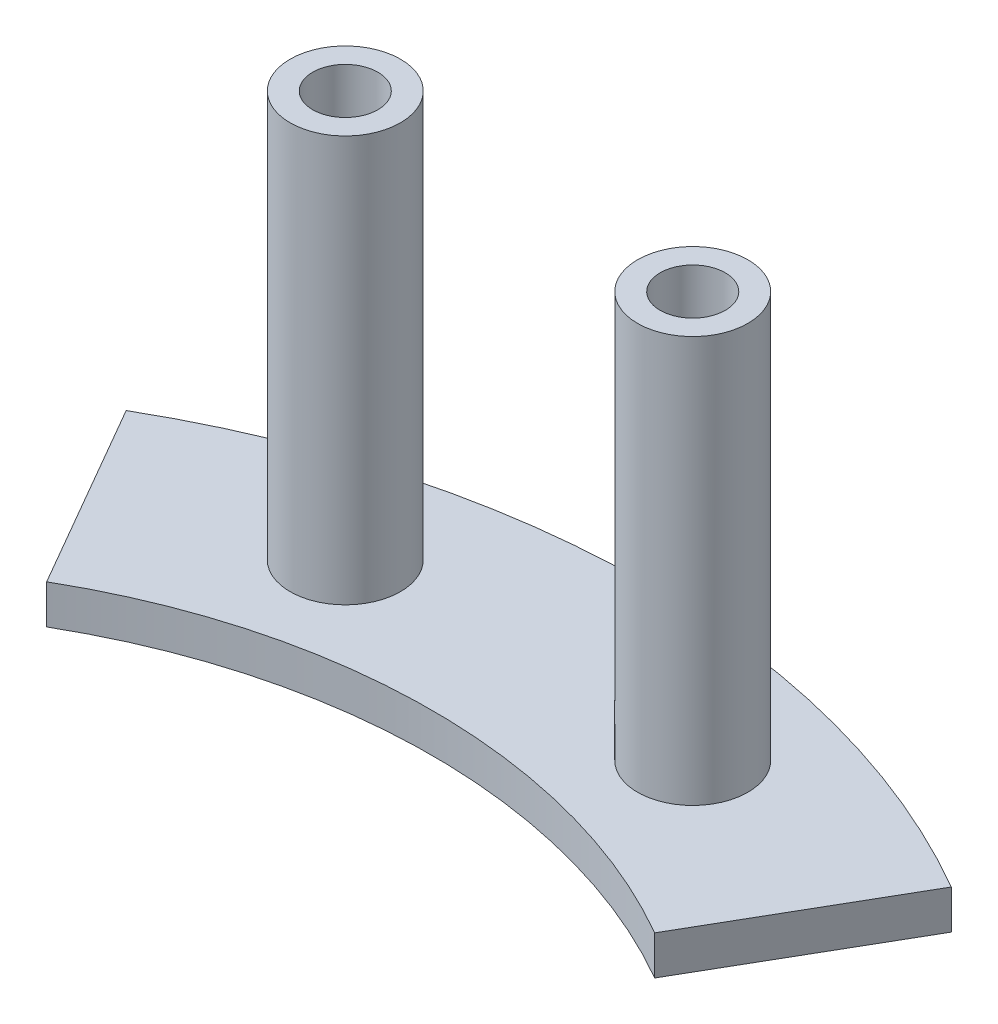
from build123d import *

# Parameters (mm, degrees)
BOSS_EXTRUDE1_DEPTH = 1.8
SKETCH2_R           = 2.54
BOSS_EXTRUDE2_DEPTH = 18.7
SKETCH5_R           = 1.5
CUT_EXTRUDE1_DEPTH  = 3


with BuildPart() as part:
    # Sketch1 → Boss-Extrude1 (new body)
    with BuildSketch(Plane(origin=(0, 0, 0), x_dir=(1, 0, 0), z_dir=(0, 1, 0))):
        with BuildLine():
            Line((-19, 32.908965344), (-14, 24.248711306))
            ThreePointArc((-14, 24.248711306), (0, 28), (14, 24.248711306))
            Line((14, 24.248711306), (19, 32.908965344))
            ThreePointArc((19, 32.908965344), (0, 38), (-19, 32.908965344))
        make_face()
    extrude(amount=BOSS_EXTRUDE1_DEPTH)

    # Sketch2 → Boss-Extrude2 (add)
    with BuildSketch(Plane(origin=(0, 1.8, 0), x_dir=(1, 0, 0), z_dir=(0, 1, 0))):
        with Locations((-8, 32)):
            Circle(SKETCH2_R)
        with Locations((8, 32)):
            Circle(SKETCH2_R)
    extrude(amount=BOSS_EXTRUDE2_DEPTH)

    # Sketch5 → Cut-Extrude1 (cut)
    with BuildSketch(Plane(origin=(0, 20.5, 0), x_dir=(1, 0, 0), z_dir=(0, 1, 0))):
        with Locations((-8, 32)):
            Circle(SKETCH5_R)
        with Locations((8, 32)):
            Circle(SKETCH5_R)
    extrude(amount=-CUT_EXTRUDE1_DEPTH, mode=Mode.SUBTRACT)


solid = part.part
